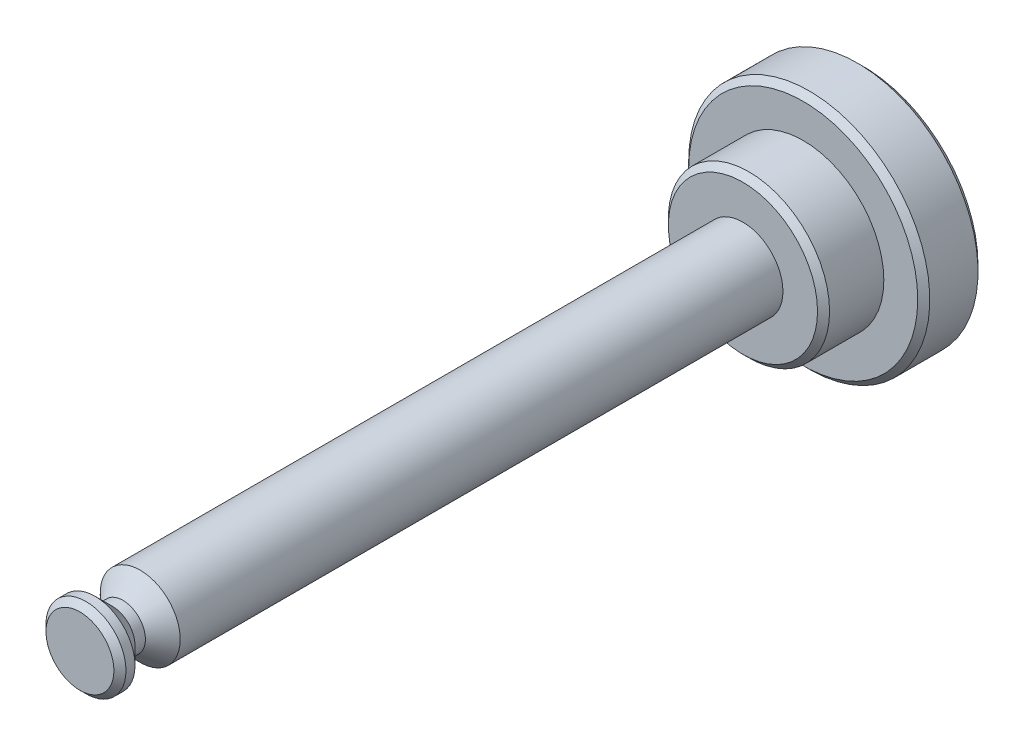
from build123d import *

# Parameters (mm, degrees)
SKETCH1_R           = 2.675
COUNTERSINK_DEPTH   = 2
SKETCH2_R           = 1.327237703
SHAFT_DEPTH         = 22
SKETCH3_R           = 4
BOSS_EXTRUDE3_DEPTH = 2
DEBURS_SIZE         = 0.2


with BuildPart() as part:
    # Sketch1 → Countersink (new body)
    with BuildSketch(Plane.XY):
        Circle(SKETCH1_R)
    extrude(amount=-COUNTERSINK_DEPTH)

    # Sketch2 → Shaft (add)
    with BuildSketch(Plane.XY):
        Circle(SKETCH2_R)
    extrude(amount=SHAFT_DEPTH)

    # Sketch3 → Boss-Extrude3 (add)
    with BuildSketch(Plane(origin=(0, 0, -2), x_dir=(-1, 0, 0), z_dir=(0, 0, -1))):
        Circle(SKETCH3_R)
    extrude(amount=BOSS_EXTRUDE3_DEPTH)

    # Sketch4 → e-Clip Notch (revolve, cut)
    with BuildSketch(Plane(origin=(0, 0, 0), x_dir=(0, 0, -1), z_dir=(1, 0, 0))):
        Polygon((-21.5, 1.327237703), (-20, 1.327237703), (-20.577237703, 0.75), (-20.922762297, 0.75), align=None)
    revolve(axis=Axis((0, 0, 0), (0, 0, 1)), mode=Mode.SUBTRACT)

    # Deburs
    deburs_edges = [part.edges().sort_by_distance(p)[0] for p in [
        (-1.327237703, 0, 22),
        (4, 0, -2),
        (4, 0, -4),
        (-2.675, 0, 0),
    ]]
    chamfer(deburs_edges, length=DEBURS_SIZE)


solid = part.part
